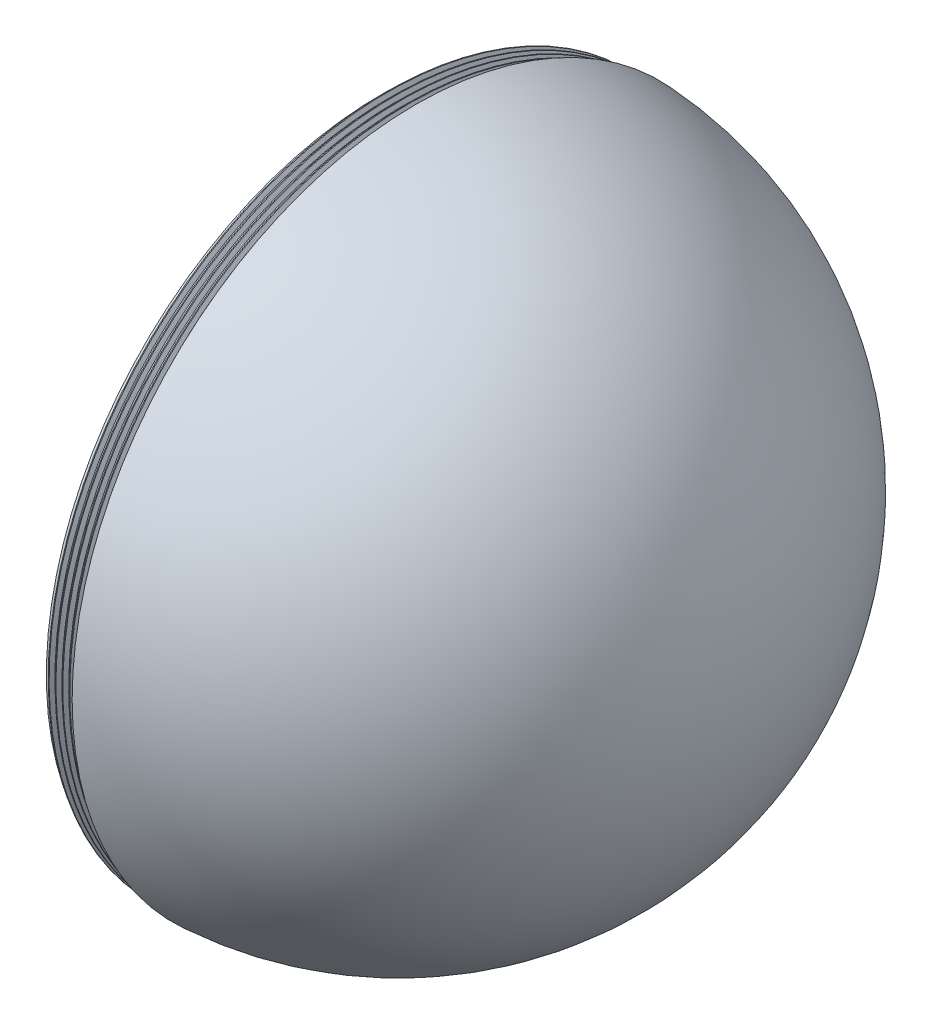
from build123d import *

# Parameters (mm, degrees)
THREAD1_PITCH = 2


with BuildPart() as part:
    # Sketch1 → Revolve3 (revolve)
    with BuildSketch(Plane.XY):
        with BuildLine():
            Line((-5, 97.371710471), (-5, 94.868329805))
            ThreePointArc((-5, 94.868329805), (65.383484153, 68.92024376), (95, 0))
            Line((95, 0), (100, 0))
            ThreePointArc((100, 0), (72.456883731, 68.92024376), (5, 99.874921777))
            Line((5, 99.874921777), (5, 97.371710471))
            Line((5, 97.371710471), (-5, 97.371710471))
        make_face()
    revolve(axis=Axis((-5, 0, 0), (1, 0, 0)))

    # Thread1: arcs per turn and ends read off the stored shape
    # Thread1: the profile of Thread Profile2 profile screwed along a right-hand helix through 5 turns, 10 arcs to a turn; built about Z, then put on its axis
    thread1_z = Axis((0, 0, 0), (0, 0, 1))
    thread1_corners = [(97.371410471, 0, -0.000173205), (98.454242221, 0, 0.624999997), (98.454242221, 0, 0.874999997), (97.371410471, 0, 1.5001732)]
    with BuildLine(mode=Mode.PRIVATE) as thread1_profile:
        Line(thread1_corners[0], thread1_corners[1])
        Line(thread1_corners[1], thread1_corners[2])
        Line(thread1_corners[2], thread1_corners[3])
        Line(thread1_corners[3], thread1_corners[0])
    thread1_cap = Face(thread1_profile.wire())
    thread1_turn_angles = [0, 18, 36, 54, 72, 90, 108, 126, 144, 162, 180, 198, 216, 234, 252, 270, 288, 306, 324, 342, 360]
    thread1_turn_weights = [1, 0.9510565162951535, 1, 0.9510565162951535, 1, 0.9510565162951535, 1, 0.9510565162951535, 1, 0.9510565162951535, 1, 0.9510565162951535, 1, 0.9510565162951535, 1, 0.9510565162951535, 1, 0.9510565162951535, 1, 0.9510565162951535, 1]
    thread1_turn_rails = [Edge.make_bspline([Vector(p[0], p[1], 0).rotate(thread1_z, thread1_turn_angles[k]) / thread1_turn_weights[k] + Vector(0, 0, p[2] + THREAD1_PITCH * thread1_turn_angles[k] / 360) for k in range(21)], [0, 0, 0, 1, 1, 2, 2, 3, 3, 4, 4, 5, 5, 6, 6, 7, 7, 8, 8, 9, 9, 10, 10, 10], 2, thread1_turn_weights) for p in thread1_corners]
    thread1_turn_sides = [Face.make_surface_from_curves(thread1_turn_rails[p[0]], thread1_turn_rails[p[1]]) for p in [(0, 1), (1, 2), (2, 3), (3, 0)]]
    thread1 = Plane(origin=(-5, 0, 0), x_dir=(0, 0, -1), z_dir=(1, 0, 0)) * Solid(Shell([*[p.moved(Location((0, 0, THREAD1_PITCH * i))) for i in range(5) for p in thread1_turn_sides], thread1_cap, thread1_cap.rotate(thread1_z, 1800).moved(Location((0, 0, THREAD1_PITCH * 1800 / 360)))]))
    add(thread1)


solid = part.part
